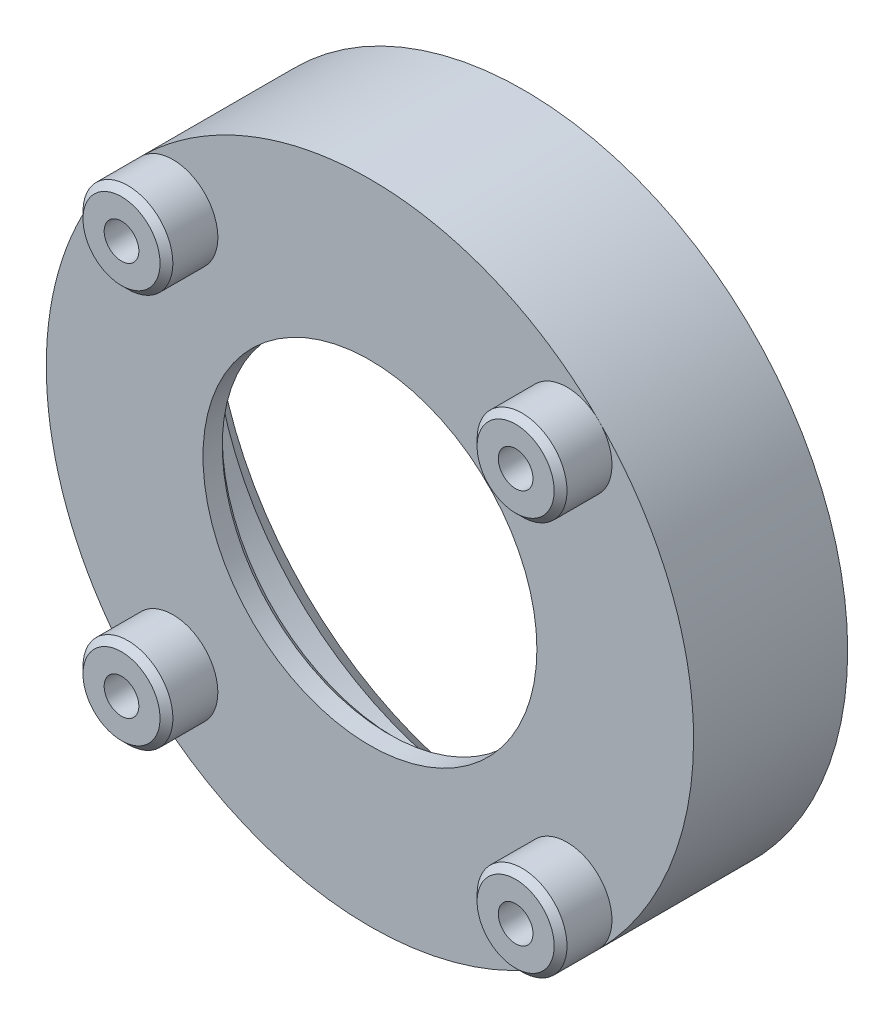
from build123d import *

# Parameters (mm, degrees)
SKETCH1_R           = 12.6
SKETCH1_R_2         = 11.1
BOSS_EXTRUDE1_DEPTH = 5
CHAMFER1_SIZE       = 1
SKETCH2_R           = 1.75
BOSS_EXTRUDE2_DEPTH = 3
BOSS_EXTRUDE3_START = 1
SKETCH3_R           = 12.6
BOSS_EXTRUDE3_DEPTH = 1
SKETCH5_R           = 6.5
CUT_EXTRUDE1_DEPTH  = 19.507295859
CHAMFER2_SIZE       = 0.25
SKETCH6_R           = 0.675
CUT_EXTRUDE2_DEPTH  = 4.5
CHAMFER3_SIZE       = 0.25


with BuildPart() as part:
    # Sketch1 → Boss-Extrude1 (new body)
    with BuildSketch(Plane.XY):
        Circle(SKETCH1_R)
        Circle(SKETCH1_R_2, mode=Mode.SUBTRACT)
    extrude(amount=-BOSS_EXTRUDE1_DEPTH)

    # Chamfer1
    chamfer1_edges = [part.edges().sort_by_distance(p)[0] for p in [
        (-11.1, 0, -5),
    ]]
    chamfer(chamfer1_edges, length=CHAMFER1_SIZE)

    # Sketch2 → Boss-Extrude2 (add)
    with BuildSketch(Plane.XY):
        with Locations((7.672108576, -7.672108576)):
            Circle(SKETCH2_R)
        with Locations((-7.672108576, -7.672108576)):
            Circle(SKETCH2_R)
        with Locations((-7.672108576, 7.672108576)):
            Circle(SKETCH2_R)
        with Locations((7.672108576, 7.672108576)):
            Circle(SKETCH2_R)
    extrude(amount=BOSS_EXTRUDE2_DEPTH)

    # Sketch3 → Boss-Extrude3 (add)
    with BuildSketch(Plane.XY.offset(BOSS_EXTRUDE3_START)):
        Circle(SKETCH3_R)
    extrude(amount=-BOSS_EXTRUDE3_DEPTH)

    # Sketch5 → Cut-Extrude1 (cut, through all)
    with BuildSketch(Plane.XY):
        Circle(SKETCH5_R)
    extrude(amount=CUT_EXTRUDE1_DEPTH, mode=Mode.SUBTRACT)

    # Chamfer2
    chamfer2_edges = [part.edges().sort_by_distance(p)[0] for p in [
        (-9.422108576, 7.672108576, 3),
        (5.922108576, 7.672108576, 3),
        (-9.422108576, -7.672108576, 3),
        (5.922108576, -7.672108576, 3),
    ]]
    chamfer(chamfer2_edges, length=CHAMFER2_SIZE)

    # Sketch6 → Cut-Extrude2 (cut)
    with BuildSketch(Plane.XY.offset(3)):
        with Locations((-7.672108576, 7.672108576)):
            Circle(SKETCH6_R)
        with Locations((-7.672108576, -7.672108576)):
            Circle(SKETCH6_R)
        with Locations((7.672108576, -7.672108576)):
            Circle(SKETCH6_R)
        with Locations((7.672108576, 7.672108576)):
            Circle(SKETCH6_R)
    extrude(amount=-CUT_EXTRUDE2_DEPTH, mode=Mode.SUBTRACT)

    # Chamfer3
    chamfer3_edges = [part.edges().sort_by_distance(p)[0] for p in [
        (-6.5, 0, 0),
    ]]
    chamfer(chamfer3_edges, length=CHAMFER3_SIZE)


solid = part.part
